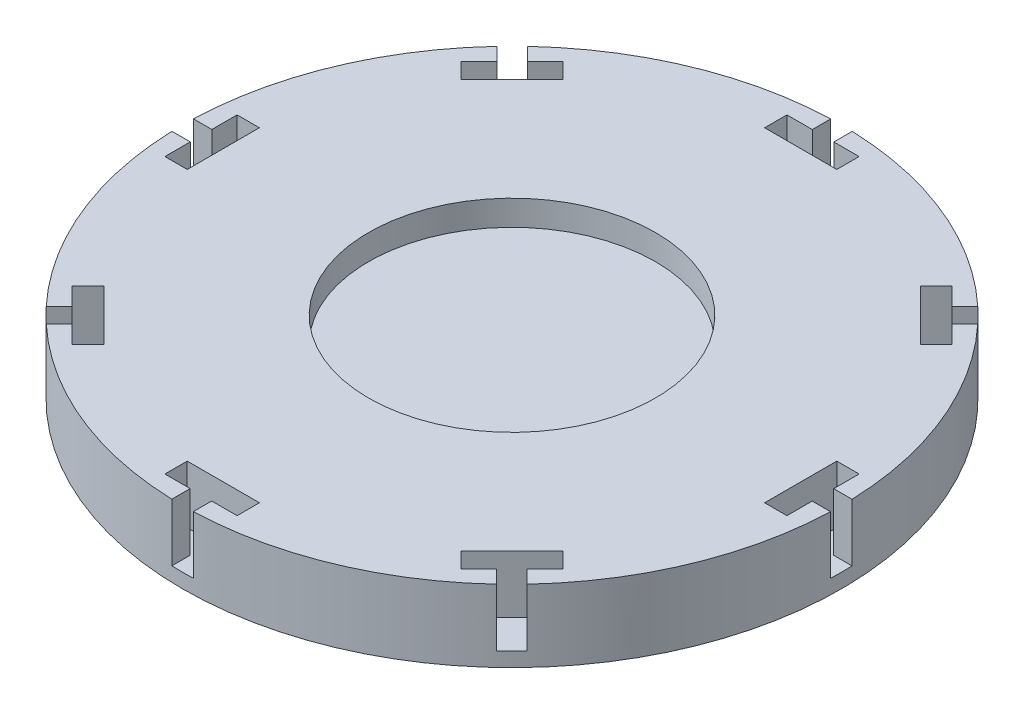
from build123d import *

# Parameters (mm, degrees)
SKETCH1_R           = 45.66
BOSS_EXTRUDE1_DEPTH = 10
SKETCH2_R           = 19.875
CUT_EXTRUDE1_DEPTH  = 3.5
CUT_EXTRUDE2_DEPTH  = 8
CIRPATTERN1_COUNT   = 8


with BuildPart() as part:
    # Sketch1 → Boss-Extrude1 (new body)
    with BuildSketch(Plane(origin=(0, 0, 0), x_dir=(1, 0, 0), z_dir=(0, 1, 0))):
        Circle(SKETCH1_R)
    extrude(amount=BOSS_EXTRUDE1_DEPTH)

    # Sketch2 → Cut-Extrude1 (cut)
    with BuildSketch(Plane(origin=(0, 10, 0), x_dir=(1, 0, 0), z_dir=(0, 1, 0))):
        Circle(SKETCH2_R)
    cut_extrude1 = extrude(amount=-CUT_EXTRUDE1_DEPTH, mode=Mode.SUBTRACT)

    # Mirror1: Cut-Extrude1 across plane
    add(cut_extrude1.mirror(Plane.ZX.offset(5)), mode=Mode.SUBTRACT)

    # Sketch3 → Cut-Extrude2 (cut)
    with BuildSketch(Plane(origin=(0, 10, 0), x_dir=(1, 0, 0), z_dir=(0, 1, 0))):
        Polygon((-5, -40), (5, -40), (5, -43.093913803), (1.482454689, -43.093913803), (1.482454689, -46.011189111), (-1.5, -46.011189111), (-1.5, -43.093913803), (-5, -43.093913803), align=None)
    cut_extrude2 = extrude(amount=-CUT_EXTRUDE2_DEPTH, mode=Mode.SUBTRACT)

    # CirPattern1: Cut-Extrude2 ×8 about axis
    cirpattern1_axis = Axis((0, 10, 0), (0, 1, 0))
    for i in range(1, CIRPATTERN1_COUNT):
        add(cut_extrude2.rotate(cirpattern1_axis, i * 360 / CIRPATTERN1_COUNT), mode=Mode.SUBTRACT)


solid = part.part
